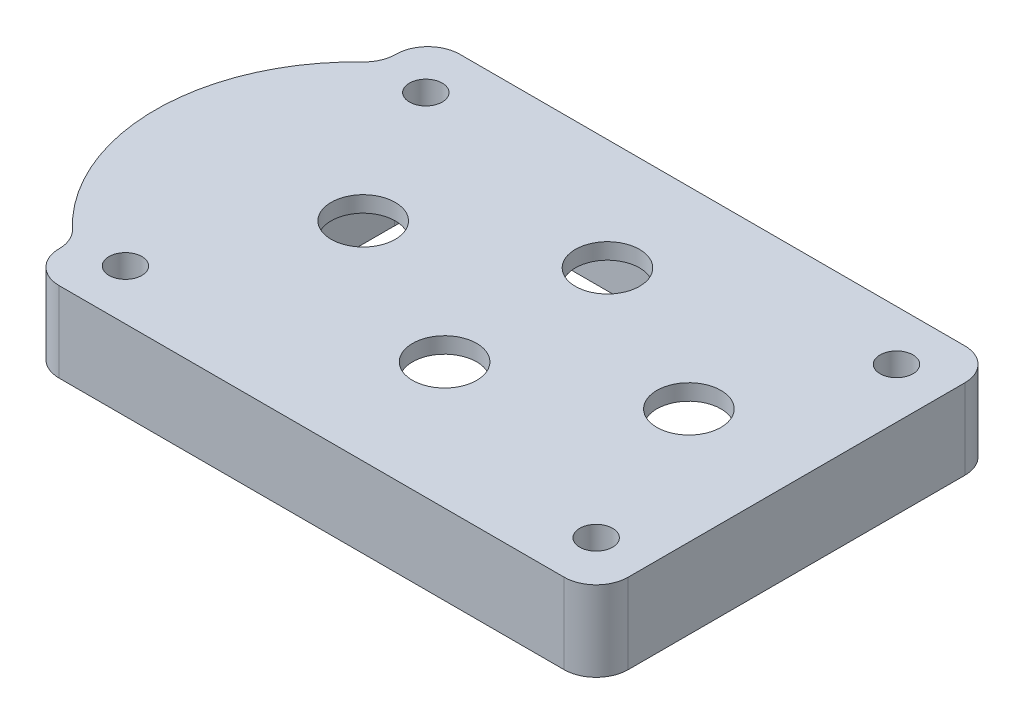
from build123d import *

# Parameters (mm, degrees)
SKETCH1_W           = 40
SKETCH1_H           = 25
BOSS_EXTRUDE1_DEPTH = 5
CUT_EXTRUDE1_DEPTH  = 25.109126902
SKETCH4_W           = 8
SKETCH4_H           = 25
BOSS_EXTRUDE2_DEPTH = 5
FILLET1_R           = 2
SKETCH5_R           = 1.025
CUT_EXTRUDE2_DEPTH  = 25.109126902
SKETCH6_R           = 2
CUT_EXTRUDE3_DEPTH  = 25.109126902
CUT_EXTRUDE4_DEPTH  = 4


with BuildPart() as part:
    # Sketch1 → Boss-Extrude1 (new body)
    with BuildSketch(Plane(origin=(0, 0, 0), x_dir=(1, 0, 0), z_dir=(0, 1, 0))):
        Rectangle(SKETCH1_W, SKETCH1_H)
    extrude(amount=BOSS_EXTRUDE1_DEPTH)

    # Sketch2 → Cut-Extrude1 (cut, through all)
    with BuildSketch(Plane(origin=(0, 5, 0), x_dir=(1, 0, 0), z_dir=(0, 1, 0))):
        with BuildLine():
            ThreePointArc((-20, 0), (-16.338834759, 8.83883477), (-7.499999984, 12.5))
            Line((-7.499999984, 12.5), (-20, 12.5))
            Line((-20, 12.5), (-20, 0))
        make_face()
        with BuildLine():
            Line((-20, -12.5), (-7.50000001, -12.5))
            ThreePointArc((-7.50000001, -12.5), (-16.338834768, -8.838834761), (-20, 0))
            Line((-20, 0), (-20, -12.5))
        make_face()
    extrude(amount=-CUT_EXTRUDE1_DEPTH, mode=Mode.SUBTRACT)

    # Sketch4 → Boss-Extrude2 (add, through all)
    with BuildSketch(Plane(origin=(0, 5, 0), x_dir=(1, 0, 0), z_dir=(0, 1, 0))):
        with Locations((-11.5, 0)):
            Rectangle(SKETCH4_W, SKETCH4_H)
    extrude(amount=-BOSS_EXTRUDE2_DEPTH)

    # Fillet1
    fillet1_edges = [part.edges().sort_by_distance(p)[0] for p in [
        (20, 2.5, 12.5),
        (20, 2.5, -12.5),
        (-15.5, 2.5, -12.5),
        (-15.5, 2.5, 12.5),
        (-15.5, 2.5, 9.604686356),
        (-15.5, 2.5, -9.604686356),
    ]]
    fillet(fillet1_edges, radius=FILLET1_R - 0.0001)  # a hair under: the kernel refuses the full size

    # Sketch5 → Cut-Extrude2 (cut, through all)
    with BuildSketch(Plane(origin=(0, 5, 0), x_dir=(1, 0, 0), z_dir=(0, 1, 0))):
        with Locations(Location((-12.496001599, 9.37, 0), (0, 0, 270))):
            Circle(SKETCH5_R)
        with Locations(Location((-12.496001599, -9.37, 0), (0, 0, 270))):
            Circle(SKETCH5_R)
        with Locations(Location((16.87, 9.37, 0), (0, 0, 270))):
            Circle(SKETCH5_R)
        with Locations(Location((16.87, -9.37, 0), (0, 0, 270))):
            Circle(SKETCH5_R)
    extrude(amount=-CUT_EXTRUDE2_DEPTH, mode=Mode.SUBTRACT)

    # Sketch6 → Cut-Extrude3 (cut, through all)
    with BuildSketch(Plane.XZ):
        with Locations(Location((-7.519296648, -0.485, 0), (0, 0, 270))):
            Circle(SKETCH6_R)
        with Locations(Location((2.640703352, 4.595, 0), (0, 0, 270))):
            Circle(SKETCH6_R)
        with Locations(Location((12.800703352, -0.485, 0), (0, 0, 270))):
            Circle(SKETCH6_R)
        with Locations(Location((2.640703352, -5.565, 0), (0, 0, 270))):
            Circle(SKETCH6_R)
    extrude(amount=-CUT_EXTRUDE3_DEPTH, mode=Mode.SUBTRACT)

    # Sketch7 → Cut-Extrude4 (cut)
    with BuildSketch(Plane.XZ):
        with BuildLine():
            Line((-11.269296648, -6.19), (-11.269296648, 5.22))
            ThreePointArc((-11.269296648, 5.22), (-10.354005339, 7.429708691), (-8.144296648, 8.345))
            Line((-8.144296648, 8.345), (13.425703352, 8.345))
            ThreePointArc((13.425703352, 8.345), (15.635412043, 7.429708691), (16.550703352, 5.22))
            Line((16.550703352, 5.22), (16.550703352, -6.19))
            ThreePointArc((16.550703352, -6.19), (15.635412043, -8.399708691), (13.425703352, -9.315))
            Line((13.425703352, -9.315), (-8.144296648, -9.315))
            ThreePointArc((-8.144296648, -9.315), (-10.354005339, -8.399708691), (-11.269296648, -6.19))
        make_face()
    extrude(amount=-CUT_EXTRUDE4_DEPTH, mode=Mode.SUBTRACT)


solid = part.part
